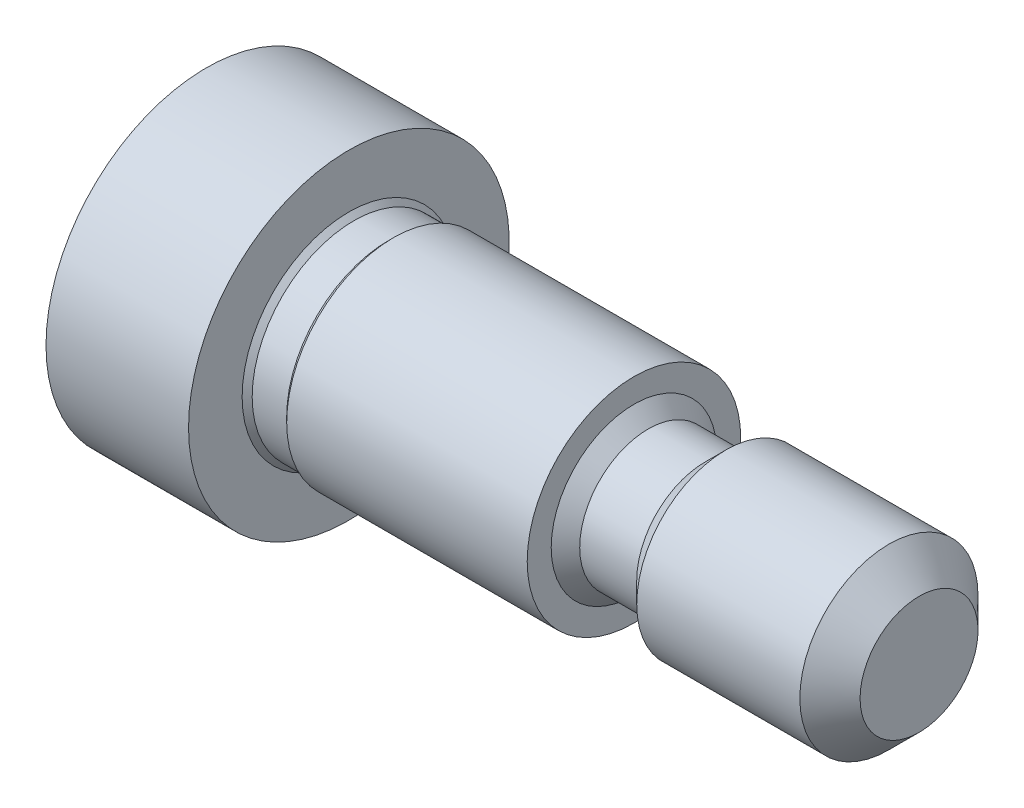
from build123d import *

# Parameters (mm, degrees)
PROPERTYMANAGER_START         = -3
PROPERTYMANAGER_OUTLINE_R     = 5.71
PROPERTYMANAGER_DEPTH         = 19
PROPERTYMANAGER_START_2       = -8
PROPERTYMANAGER_2_OUTLINE_R   = 9
PROPERTYMANAGER_2_DEPTH       = 8
PROPERTYMANAGER_START_3       = 21.1549999
PROPERTYMANAGER_3_OUTLINE_R   = 5
PROPERTYMANAGER_3_DEPTH       = 9.1545
PROPERTYMANAGER_START_4       = 16
PROPERTYMANAGER_4_OUTLINE_R   = 3.845
PROPERTYMANAGER_4_DEPTH       = 14.3094999
PROPERTYMANAGER_START_5       = 2.4999999
PROPERTYMANAGER_5_OUTLINE_R   = 5.992
PROPERTYMANAGER_5_OUTLINE_R_2 = 5.71
PROPERTYMANAGER_5_DEPTH       = 13.5000001
HEXDRIVE_DEPTH                = 5


with BuildPart() as part:
    # PropertyManager: read off the stored shape, not the designer's step
    # PropertyManager outline → PropertyManager (new body)
    with BuildSketch(Plane.YZ.offset(PROPERTYMANAGER_START)):
        Circle(PROPERTYMANAGER_OUTLINE_R)
    extrude(amount=PROPERTYMANAGER_DEPTH)

    # PropertyManager 2 outline → PropertyManager 2 (add)
    with BuildSketch(Plane.YZ.offset(PROPERTYMANAGER_START_2)):
        Circle(PROPERTYMANAGER_2_OUTLINE_R)
        Polygon((0, 3.518949891), (3.0475, 1.759474945), (3.0475, -1.759474945), (0, -3.518949891), (-3.0475, -1.759474945), (-3.0475, 1.759474945), align=None, mode=Mode.SUBTRACT)
    extrude(amount=PROPERTYMANAGER_2_DEPTH)



with BuildPart() as body_2:
    # PropertyManager 3 outline → PropertyManager 3 (new body)
    with BuildSketch(Plane.YZ.offset(PROPERTYMANAGER_START_3)):
        Circle(PROPERTYMANAGER_3_OUTLINE_R)
    extrude(amount=PROPERTYMANAGER_3_DEPTH)


with BuildPart() as part_1:
    add(part.part)

    add(body_2.part)  # PropertyManager 4 merges body 2
    # PropertyManager 4 outline → PropertyManager 4 (add)
    with BuildSketch(Plane.YZ.offset(PROPERTYMANAGER_START_4)):
        Circle(PROPERTYMANAGER_4_OUTLINE_R)
    extrude(amount=PROPERTYMANAGER_4_DEPTH)

    # PropertyManager 5 outline → PropertyManager 5 (add)
    with BuildSketch(Plane.YZ.offset(PROPERTYMANAGER_START_5)):
        Circle(PROPERTYMANAGER_5_OUTLINE_R)
        Circle(PROPERTYMANAGER_5_OUTLINE_R_2, mode=Mode.SUBTRACT)
    extrude(amount=PROPERTYMANAGER_5_DEPTH)

    # PropertyManager 6 outline → PropertyManager 6 (revolve)
    with BuildSketch(Plane.YX):
        Polygon((3.3095, 32), (0, 32), (0, 30.3094999), (5, 30.30949995), align=None)
        Polygon((3.845, 21.1549999), (3.845, 20), (5, 21.15499995), align=None)
        Polygon((4.645, 16), (3.845, 16.8), (3.845, 16), align=None)
        Polygon((5.992, 2.4999999), (5.71, 2.4999999), (5.71, 2.218), align=None)
        Polygon((5.992, 0), (5.71, 0.282), (5.71, 0), align=None)
    revolve(axis=Axis((0, 0, 0), (1, 0, 0)))

    # BodySketch → BaseBody (revolve)
    with BuildSketch(Plane(origin=(0, 0, 0), x_dir=(1, 0, 0), z_dir=(0, 1, 0)), mode=Mode.PRIVATE) as basebody_sk:
        Polygon((0, 9), (-8, 9), (-8, 0), (32, 0), (32, 3.3095), (30.3095, 5), (21.155, 5), (20, 3.845), (16.8, 3.845), (16, 4.645), (16, 5.992), (2.5, 5.992), (2.218, 5.71), (0.282, 5.71), (0, 5.992), align=None)
    revolve(basebody_sk.sketch.rotate(Axis((-8, 0, 0), (1, 0, 0)), 180), axis=Axis((-8, 0, 0), (1, 0, 0)))

    # DriveSketch → HexDrive (cut)
    with BuildSketch(Plane.ZY.offset(8)):
        Polygon((3.518949891, 0), (1.759474945, 3.0475), (-1.759474945, 3.0475), (-3.518949891, 0), (-1.759474945, -3.0475), (1.759474945, -3.0475), align=None)
    extrude(amount=-HEXDRIVE_DEPTH, mode=Mode.SUBTRACT)


solid = part_1.part
